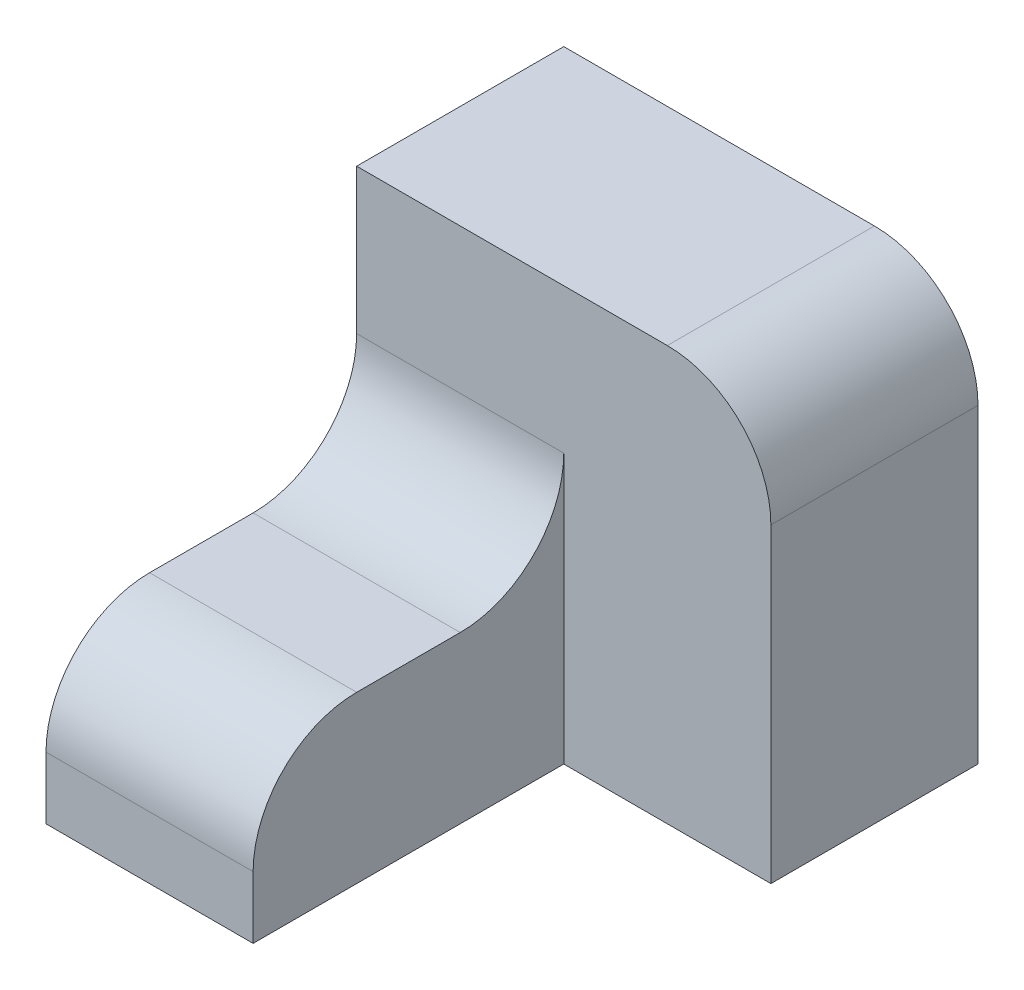
from build123d import *

# Parameters (mm, degrees)
SKETCH1_W           = 20
SKETCH1_H           = 16
BOSS_EXTRUDE1_DEPTH = 30
SKETCH2_W           = 40
SKETCH2_H           = 40
BOSS_EXTRUDE2_DEPTH = 20
FILLET1_R           = 10


with BuildPart() as part:
    # Sketch1 → Boss-Extrude1 (new body)
    with BuildSketch(Plane.XY):
        with Locations((-20, -8)):
            Rectangle(SKETCH1_W, SKETCH1_H)
    extrude(amount=BOSS_EXTRUDE1_DEPTH)

    # Sketch2 → Boss-Extrude2 (add)
    with BuildSketch(Plane.XY):
        with Locations((-10, 4)):
            Rectangle(SKETCH2_W, SKETCH2_H)
    extrude(amount=-BOSS_EXTRUDE2_DEPTH)

    # Fillet1
    fillet1_edges = [part.edges().sort_by_distance(p)[0] for p in [
        (-20, 0, 0),
        (10, 24, -10),
        (-20, 0, 30),
    ]]
    fillet(fillet1_edges, radius=FILLET1_R)


solid = part.part
